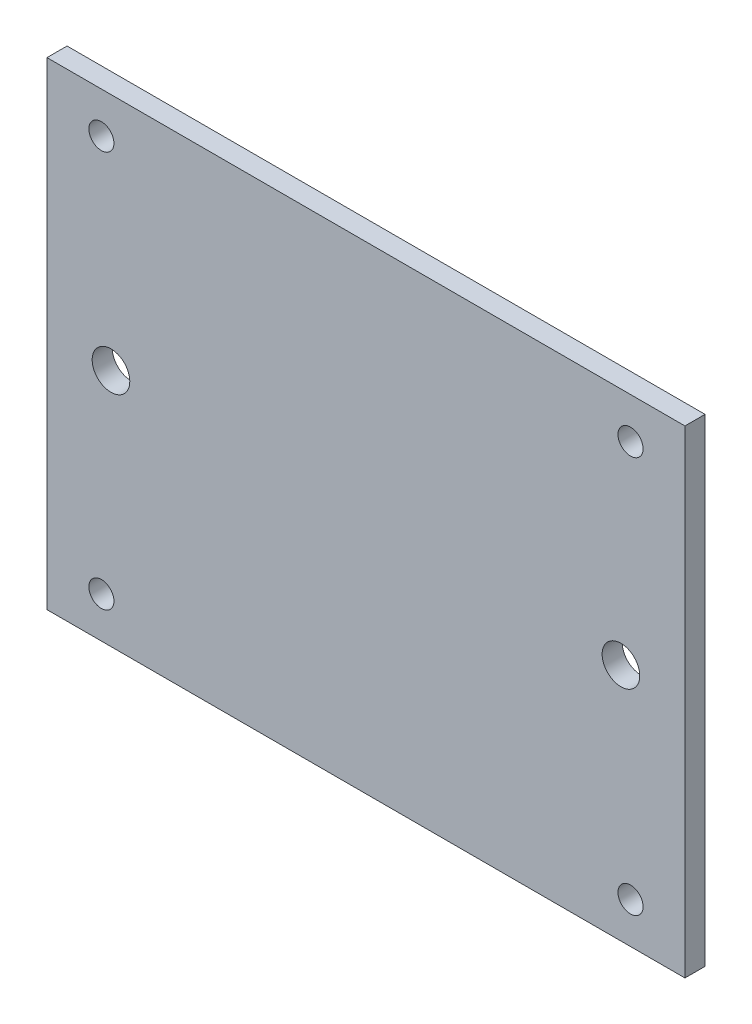
from build123d import *

# Parameters (mm, degrees)
SKETCH1_W           = 50.84
SKETCH1_H           = 38.1
SKETCH1_R           = 1
SKETCH1_R_2         = 1.5
BOSS_EXTRUDE1_DEPTH = 1.6


with BuildPart() as part:
    # Sketch1 → Boss-Extrude1 (new body)
    with BuildSketch(Plane.XY):
        Rectangle(SKETCH1_W, SKETCH1_H)
        with Locations((-21.083254593, 15.8)):
            Circle(SKETCH1_R, mode=Mode.SUBTRACT)
        with Locations((21.083254593, 15.8)):
            Circle(SKETCH1_R, mode=Mode.SUBTRACT)
        with Locations((21.083254593, -15.8)):
            Circle(SKETCH1_R, mode=Mode.SUBTRACT)
        with Locations((-21.083254593, -15.8)):
            Circle(SKETCH1_R, mode=Mode.SUBTRACT)
        with Locations((-20.32, 0)):
            Circle(SKETCH1_R_2, mode=Mode.SUBTRACT)
        with Locations((20.32, 0)):
            Circle(SKETCH1_R_2, mode=Mode.SUBTRACT)
    extrude(amount=BOSS_EXTRUDE1_DEPTH)


solid = part.part
